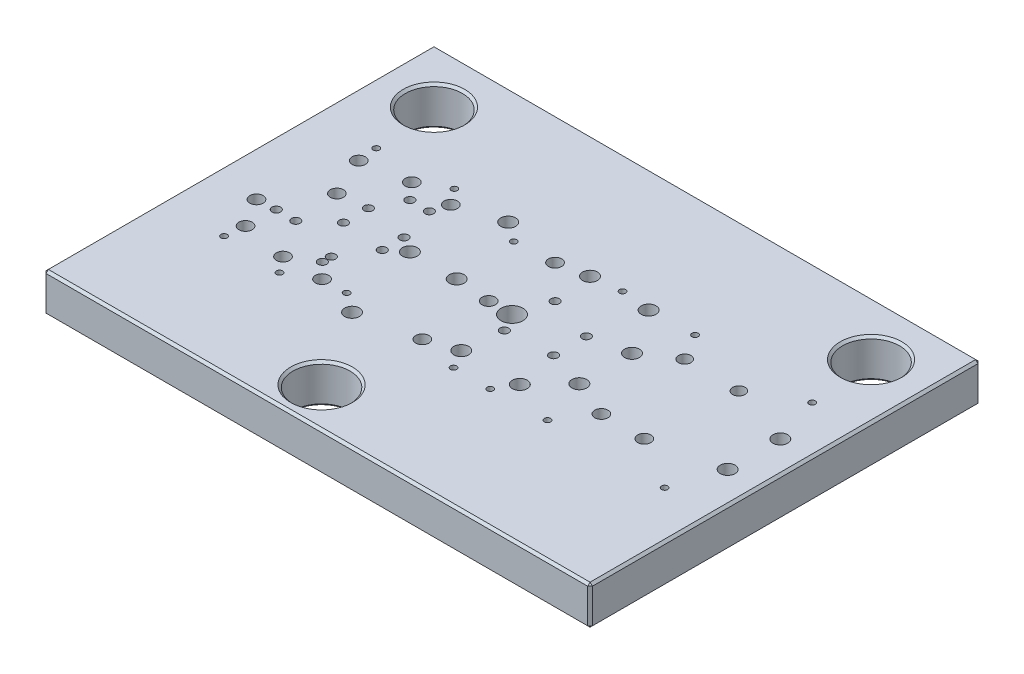
from build123d import *

# Parameters (mm, degrees)
SKETCH1_W                  = 700
SKETCH1_H                  = 500
BOSS_EXTRUDE1_DEPTH        = 50
CUT_EXTRUDE1_REACH         = 435.013
SKETCH2_R                  = 36.5
CHAMFER1_SIZE              = 3
CHAMFER2_SIZE              = 3
M30X2_0_TAPPED_HOLE1_D     = 28
CUT_EXTRUDE2_REACH         = 435.013
SKETCH7_R                  = 6
CUT_EXTRUDE3_REACH         = 435.013
SKETCH8_R                  = 8.5
CUT_EXTRUDE4_REACH         = 435.013
SKETCH9_R                  = 8
SKETCH11_R                 = 9.5
CUT_EXTRUDE5_DEPTH         = 36.8
M10_TAPPED_HOLE1_D         = 8.5
M10_TAPPED_HOLE1_DEPTH     = 27.5
M10_TAPPED_HOLE1_TIP       = 2.553657631
F_8_0MM_DOWEL_HOLE1_D      = 8
M8_TAPPED_HOLE1_D          = 6.8
M8_TAPPED_HOLE1_DEPTH      = 22.25
M8_TAPPED_HOLE1_TIP        = 2.042926105
F_8_0MM_DOWEL_HOLE2_D      = 8
F_11_0_11_DIAMETER_HOLE1_D = 11
SKETCH27_R                 = 6
CUT_EXTRUDE6_DEPTH         = 434.012701892
SKETCH29_R                 = 9.5
CUT_EXTRUDE7_DEPTH         = 36.8
SKETCH30_R                 = 5
CUT_EXTRUDE8_DEPTH         = 434.012701892
SKETCH31_R                 = 8.5
CUT_EXTRUDE9_DEPTH         = 39.8
M8_TAPPED_HOLE2_D          = 6.8
M8_TAPPED_HOLE2_DEPTH      = 22.25
M8_TAPPED_HOLE2_TIP        = 2.042926105
F_8_0MM_DOWEL_HOLE3_D      = 8
SKETCH38_R                 = 6
CUT_EXTRUDE10_DEPTH        = 434.012701892
SKETCH39_R                 = 9.5
CUT_EXTRUDE11_DEPTH        = 36.8
SKETCH40_R                 = 10
CUT_EXTRUDE12_DEPTH        = 9.2
F_10_0_10_DIAMETER_HOLE1_D = 10
SKETCH45_R                 = 8.5
CUT_EXTRUDE13_DEPTH        = 33.8
F_11_0_11_DIAMETER_HOLE2_D = 11
M8_TAPPED_HOLE3_D          = 6.8
M8_TAPPED_HOLE3_DEPTH      = 22.25
M8_TAPPED_HOLE3_TIP        = 2.042926105
F_8_0MM_DOWEL_HOLE4_D      = 8
SKETCH57_R                 = 5
CUT_EXTRUDE14_DEPTH        = 434.012701892
SKETCH58_R                 = 8.5
CUT_EXTRUDE15_DEPTH        = 36.8
F_11_0_11_DIAMETER_HOLE3_D = 11
M8_TAPPED_HOLE4_D          = 6.8
M8_TAPPED_HOLE4_DEPTH      = 22.25
M8_TAPPED_HOLE4_TIP        = 2.042926105
F_8_0MM_DOWEL_HOLE5_D      = 8
M10_TAPPED_HOLE2_D         = 8.5
M10_TAPPED_HOLE2_DEPTH     = 27.5
M10_TAPPED_HOLE2_TIP       = 2.553657631


with BuildPart() as part:
    # Sketch1 → Boss-Extrude1 (new body)
    with BuildSketch(Plane(origin=(0, 0, 0), x_dir=(1, 0, 0), z_dir=(0, 1, 0))):
        Rectangle(SKETCH1_W, SKETCH1_H)
    extrude(amount=-BOSS_EXTRUDE1_DEPTH)

    # Sketch2 → Cut-Extrude1 (cut, up to next)
    with BuildSketch(Plane(origin=(0, 0, 0), x_dir=(1, 0, 0), z_dir=(0, 1, 0)), mode=Mode.PRIVATE) as cut_extrude1_sk1:
        with Locations((-280, 180)):
            Circle(SKETCH2_R)
    cut_extrude1_tool1 = extrude(cut_extrude1_sk1.sketch, amount=-CUT_EXTRUDE1_REACH, mode=Mode.PRIVATE) & part.part
    # Sketch2 → Cut-Extrude1 (cut, up to next)
    with BuildSketch(Plane(origin=(0, 0, 0), x_dir=(1, 0, 0), z_dir=(0, 1, 0)), mode=Mode.PRIVATE) as cut_extrude1_sk2:
        with Locations((280, 180)):
            Circle(SKETCH2_R)
    cut_extrude1_tool2 = extrude(cut_extrude1_sk2.sketch, amount=-CUT_EXTRUDE1_REACH, mode=Mode.PRIVATE) & part.part
    # Sketch2 → Cut-Extrude1 (cut, up to next)
    with BuildSketch(Plane(origin=(0, 0, 0), x_dir=(1, 0, 0), z_dir=(0, 1, 0)), mode=Mode.PRIVATE) as cut_extrude1_sk3:
        with Locations((-44, -200)):
            Circle(SKETCH2_R)
    cut_extrude1_tool3 = extrude(cut_extrude1_sk3.sketch, amount=-CUT_EXTRUDE1_REACH, mode=Mode.PRIVATE) & part.part
    add(cut_extrude1_tool1.solids().sort_by_distance((-280, 0, -180))[0], mode=Mode.SUBTRACT)
    add(cut_extrude1_tool2.solids().sort_by_distance((280, 0, -180))[0], mode=Mode.SUBTRACT)
    add(cut_extrude1_tool3.solids().sort_by_distance((-44, 0, 200))[0], mode=Mode.SUBTRACT)

    # Chamfer1
    chamfer1_edges = [part.edges().sort_by_distance(p)[0] for p in [
        (243.5, -50, -180),
        (243.5, 0, -180),
        (-316.5, -50, -180),
        (-316.5, 0, -180),
        (-80.5, -50, 200),
        (-80.5, 0, 200),
    ]]
    chamfer(chamfer1_edges, length=CHAMFER1_SIZE)

    # Chamfer2
    chamfer2_edges = [part.edges().sort_by_distance(p)[0] for p in [
        (-350, -25, -250),
        (-350, -25, 250),
        (350, -25, -250),
        (0, -50, -250),
        (-350, -50, 0),
        (0, -50, 250),
        (350, -50, 0),
        (350, -25, 250),
        (350, 0, 0),
        (0, 0, -250),
        (-350, 0, 0),
        (0, 0, 250),
    ]]
    chamfer(chamfer2_edges, length=CHAMFER2_SIZE)

    # M30x2.0 Tapped Hole1 (through all)
    with Locations(Plane(origin=(0, 0, 0), x_dir=(1, 0, 0), z_dir=(0, 1, 0))):
        with Locations((0, 0)):
            Hole(M30X2_0_TAPPED_HOLE1_D / 2)

    # Sketch7 → Cut-Extrude2 (cut, up to next)
    with BuildSketch(Plane(origin=(0, 0, 0), x_dir=(1, 0, 0), z_dir=(0, 1, 0)), mode=Mode.PRIVATE) as cut_extrude2_sk1:
        with Locations((310, 33.75)):
            Circle(SKETCH7_R)
    cut_extrude2_tool1 = extrude(cut_extrude2_sk1.sketch, amount=-CUT_EXTRUDE2_REACH, mode=Mode.PRIVATE) & part.part
    # Sketch7 → Cut-Extrude2 (cut, up to next)
    with BuildSketch(Plane(origin=(0, 0, 0), x_dir=(1, 0, 0), z_dir=(0, 1, 0)), mode=Mode.PRIVATE) as cut_extrude2_sk2:
        with Locations((310, -33.75)):
            Circle(SKETCH7_R)
    cut_extrude2_tool2 = extrude(cut_extrude2_sk2.sketch, amount=-CUT_EXTRUDE2_REACH, mode=Mode.PRIVATE) & part.part
    # Sketch7 → Cut-Extrude2 (cut, up to next)
    with BuildSketch(Plane(origin=(0, 0, 0), x_dir=(1, 0, 0), z_dir=(0, 1, 0)), mode=Mode.PRIVATE) as cut_extrude2_sk3:
        with Locations((120, -33.75)):
            Circle(SKETCH7_R)
    cut_extrude2_tool3 = extrude(cut_extrude2_sk3.sketch, amount=-CUT_EXTRUDE2_REACH, mode=Mode.PRIVATE) & part.part
    # Sketch7 → Cut-Extrude2 (cut, up to next)
    with BuildSketch(Plane(origin=(0, 0, 0), x_dir=(1, 0, 0), z_dir=(0, 1, 0)), mode=Mode.PRIVATE) as cut_extrude2_sk4:
        with Locations((120, 33.75)):
            Circle(SKETCH7_R)
    cut_extrude2_tool4 = extrude(cut_extrude2_sk4.sketch, amount=-CUT_EXTRUDE2_REACH, mode=Mode.PRIVATE) & part.part
    add(cut_extrude2_tool1.solids().sort_by_distance((310, 0, -33.75))[0], mode=Mode.SUBTRACT)
    add(cut_extrude2_tool2.solids().sort_by_distance((310, 0, 33.75))[0], mode=Mode.SUBTRACT)
    add(cut_extrude2_tool3.solids().sort_by_distance((120, 0, 33.75))[0], mode=Mode.SUBTRACT)
    add(cut_extrude2_tool4.solids().sort_by_distance((120, 0, -33.75))[0], mode=Mode.SUBTRACT)

    # Sketch8 → Cut-Extrude3 (cut, up to next)
    with BuildSketch(Plane(origin=(0, 0, 0), x_dir=(1, 0, 0), z_dir=(0, 1, 0)), mode=Mode.PRIVATE) as cut_extrude3_sk1:
        with Locations((222.63, -53.14)):
            Circle(SKETCH8_R)
    cut_extrude3_tool1 = extrude(cut_extrude3_sk1.sketch, amount=-CUT_EXTRUDE3_REACH, mode=Mode.PRIVATE) & part.part
    # Sketch8 → Cut-Extrude3 (cut, up to next)
    with BuildSketch(Plane(origin=(0, 0, 0), x_dir=(1, 0, 0), z_dir=(0, 1, 0)), mode=Mode.PRIVATE) as cut_extrude3_sk2:
        with Locations((167.63, -53.14)):
            Circle(SKETCH8_R)
    cut_extrude3_tool2 = extrude(cut_extrude3_sk2.sketch, amount=-CUT_EXTRUDE3_REACH, mode=Mode.PRIVATE) & part.part
    add(cut_extrude3_tool1.solids().sort_by_distance((222.63, 0, 53.14))[0], mode=Mode.SUBTRACT)
    add(cut_extrude3_tool2.solids().sort_by_distance((167.63, 0, 53.14))[0], mode=Mode.SUBTRACT)

    # Sketch9 → Cut-Extrude4 (cut, up to next)
    with BuildSketch(Plane(origin=(0, 0, 0), x_dir=(1, 0, 0), z_dir=(0, 1, 0)), mode=Mode.PRIVATE) as cut_extrude4_sk1:
        with Locations((160.13, 61.13)):
            Circle(SKETCH9_R)
    cut_extrude4_tool1 = extrude(cut_extrude4_sk1.sketch, amount=-CUT_EXTRUDE4_REACH, mode=Mode.PRIVATE) & part.part
    # Sketch9 → Cut-Extrude4 (cut, up to next)
    with BuildSketch(Plane(origin=(0, 0, 0), x_dir=(1, 0, 0), z_dir=(0, 1, 0)), mode=Mode.PRIVATE) as cut_extrude4_sk2:
        with Locations((230.13, 60.5)):
            Circle(SKETCH9_R)
    cut_extrude4_tool2 = extrude(cut_extrude4_sk2.sketch, amount=-CUT_EXTRUDE4_REACH, mode=Mode.PRIVATE) & part.part
    add(cut_extrude4_tool1.solids().sort_by_distance((160.13, 0, -61.13))[0], mode=Mode.SUBTRACT)
    add(cut_extrude4_tool2.solids().sort_by_distance((230.13, 0, -60.5))[0], mode=Mode.SUBTRACT)

    # Sketch11 → Cut-Extrude5 (cut)
    with BuildSketch(Plane(origin=(0, 0, 0), x_dir=(1, 0, 0), z_dir=(0, 1, 0))):
        with Locations((310, -33.75)):
            Circle(SKETCH11_R)
        with Locations((310, 33.75)):
            Circle(SKETCH11_R)
        with Locations((120, -33.75)):
            Circle(SKETCH11_R)
        with Locations((120, 33.75)):
            Circle(SKETCH11_R)
    extrude(amount=-CUT_EXTRUDE5_DEPTH, mode=Mode.SUBTRACT)

    # M10 Tapped Hole1
    with Locations(Plane(origin=(0, -50, 0), x_dir=(-1, 0, 0), z_dir=(0, -1, 0))):
        with Locations((-307, -94.5), (-123, -94.5), (-123, 94.5), (-307, 94.5)):
            Hole(M10_TAPPED_HOLE1_D / 2, depth=M10_TAPPED_HOLE1_DEPTH)
            with Locations((0, 0, -(M10_TAPPED_HOLE1_DEPTH + M10_TAPPED_HOLE1_TIP / 2))):  # 118° drill point
                Cone(0, M10_TAPPED_HOLE1_D / 2, M10_TAPPED_HOLE1_TIP, mode=Mode.SUBTRACT)

    # Ø8.0mm Dowel Hole1 (through all)
    with Locations(Plane(origin=(0, 0, 0), x_dir=(1, 0, 0), z_dir=(0, 1, 0))):
        with Locations((290, 94.5), (140, 94.5), (290, -94.5), (140, -94.5)):
            Hole(F_8_0MM_DOWEL_HOLE1_D / 2)

    # M8 Tapped Hole1
    with Locations(Plane.XZ.offset(50)):
        with Locations((62.13, -96.5), (28.13, -96.5), (84.13, 96.5), (6.13, 96.5)):
            Hole(M8_TAPPED_HOLE1_D / 2, depth=M8_TAPPED_HOLE1_DEPTH)
            with Locations((0, 0, -(M8_TAPPED_HOLE1_DEPTH + M8_TAPPED_HOLE1_TIP / 2))):  # 118° drill point
                Cone(0, M8_TAPPED_HOLE1_D / 2, M8_TAPPED_HOLE1_TIP, mode=Mode.SUBTRACT)

    # Ø8.0mm Dowel Hole2 (through all)
    with Locations(Plane(origin=(0, 0, 0), x_dir=(1, 0, 0), z_dir=(0, 1, 0))):
        with Locations((68.63, -96.5), (21.63, -96.5), (45.13, 96.5)):
            Hole(F_8_0MM_DOWEL_HOLE2_D / 2)

    # Ø11.0 (11) Diameter Hole1 (through all)
    with Locations(Plane(origin=(0, 0, 0), x_dir=(1, 0, 0), z_dir=(0, 1, 0))):
        with Locations((71.88, -18.64), (12.88, -22.64), (71.88, 23.36), (12.88, 42.36)):
            Hole(F_11_0_11_DIAMETER_HOLE1_D / 2)

    # Sketch27 → Cut-Extrude6 (cut, through all)
    with BuildSketch(Plane(origin=(0, 0, 0), x_dir=(1, 0, 0), z_dir=(0, 1, 0))):
        with Locations((7.63, 92.36)):
            Circle(SKETCH27_R)
        with Locations((82.63, 92.36)):
            Circle(SKETCH27_R)
        with Locations((82.63, -72.64)):
            Circle(SKETCH27_R)
        with Locations((7.63, -72.64)):
            Circle(SKETCH27_R)
    extrude(amount=-CUT_EXTRUDE6_DEPTH, mode=Mode.SUBTRACT)

    # Sketch29 → Cut-Extrude7 (cut)
    with BuildSketch(Plane(origin=(0, 0, 0), x_dir=(1, 0, 0), z_dir=(0, 1, 0))):
        with Locations((7.63, 92.36)):
            Circle(SKETCH29_R)
        with Locations((82.63, 92.36)):
            Circle(SKETCH29_R)
        with Locations((7.63, -72.64)):
            Circle(SKETCH29_R)
        with Locations((82.63, -72.64)):
            Circle(SKETCH29_R)
    extrude(amount=-CUT_EXTRUDE7_DEPTH, mode=Mode.SUBTRACT)

    # Sketch30 → Cut-Extrude8 (cut, through all)
    with BuildSketch(Plane(origin=(0, 0, 0), x_dir=(1, 0, 0), z_dir=(0, 1, 0))):
        with Locations((-29.87, 85)):
            Circle(SKETCH30_R)
        with Locations((-29.87, 0)):
            Circle(SKETCH30_R)
        with Locations((-29.87, -85)):
            Circle(SKETCH30_R)
    extrude(amount=-CUT_EXTRUDE8_DEPTH, mode=Mode.SUBTRACT)

    # Sketch31 → Cut-Extrude9 (cut)
    with BuildSketch(Plane(origin=(0, 0, 0), x_dir=(1, 0, 0), z_dir=(0, 1, 0))):
        with Locations((-29.87, 85)):
            Circle(SKETCH31_R)
        with Locations((-29.87, 0)):
            Circle(SKETCH31_R)
        with Locations((-29.87, -85)):
            Circle(SKETCH31_R)
    extrude(amount=-CUT_EXTRUDE9_DEPTH, mode=Mode.SUBTRACT)

    # M8 Tapped Hole2
    with Locations(Plane(origin=(0, -50, 0), x_dir=(-1, 0, 0), z_dir=(0, -1, 0))):
        with Locations((79.87, -97.5), (129.87, -97.5), (79.87, 97.5), (129.87, 97.5)):
            Hole(M8_TAPPED_HOLE2_D / 2, depth=M8_TAPPED_HOLE2_DEPTH)
            with Locations((0, 0, -(M8_TAPPED_HOLE2_DEPTH + M8_TAPPED_HOLE2_TIP / 2))):  # 118° drill point
                Cone(0, M8_TAPPED_HOLE2_D / 2, M8_TAPPED_HOLE2_TIP, mode=Mode.SUBTRACT)

    # Ø8.0mm Dowel Hole3 (through all)
    with Locations(Plane(origin=(0, 0, 0), x_dir=(1, 0, 0), z_dir=(0, 1, 0))):
        with Locations((-79.87, 81.975), (-129.87, -82)):
            Hole(F_8_0MM_DOWEL_HOLE3_D / 2)

    # Sketch38 → Cut-Extrude10 (cut, through all)
    with BuildSketch(Plane(origin=(0, 0, 0), x_dir=(1, 0, 0), z_dir=(0, 1, 0))):
        with Locations((-104.87, 100)):
            Circle(SKETCH38_R)
        with Locations((-104.87, -100)):
            Circle(SKETCH38_R)
        with Locations((-74.87, 4)):
            Circle(SKETCH38_R)
        with Locations((-134.87, 4)):
            Circle(SKETCH38_R)
    extrude(amount=-CUT_EXTRUDE10_DEPTH, mode=Mode.SUBTRACT)

    # Sketch39 → Cut-Extrude11 (cut)
    with BuildSketch(Plane(origin=(0, 0, 0), x_dir=(1, 0, 0), z_dir=(0, 1, 0))):
        with Locations((-104.87, 100)):
            Circle(SKETCH39_R)
        with Locations((-104.87, -100)):
            Circle(SKETCH39_R)
        with Locations((-74.87, 4)):
            Circle(SKETCH39_R)
        with Locations((-134.87, 4)):
            Circle(SKETCH39_R)
    extrude(amount=-CUT_EXTRUDE11_DEPTH, mode=Mode.SUBTRACT)

    # Sketch40 → Cut-Extrude12 (cut)
    with BuildSketch(Plane.XZ.offset(50)):
        with Locations((-185.87, -82.5)):
            Circle(SKETCH40_R)
        with Locations((-210.87, 82.5)):
            Circle(SKETCH40_R)
        with Locations((-185.87, 82.5)):
            Circle(SKETCH40_R)
        with Locations((-160.87, 82.5)):
            Circle(SKETCH40_R)
        with Locations((-160.87, 33)):
            Circle(SKETCH40_R)
        with Locations((-210.87, 33)):
            Circle(SKETCH40_R)
        with Locations((-160.87, -39)):
            Circle(SKETCH40_R)
        with Locations((-160.87, -82.5)):
            Circle(SKETCH40_R)
        with Locations((-210.87, -82.5)):
            Circle(SKETCH40_R)
        with Locations((-210.87, -47)):
            Circle(SKETCH40_R)
    extrude(amount=-CUT_EXTRUDE12_DEPTH, mode=Mode.SUBTRACT)

    # Ø10.0 (10) Diameter Hole1 (through all)
    with Locations(Plane(origin=(0, 0, 0), x_dir=(1, 0, 0), z_dir=(0, 1, 0))):
        with Locations((-160.87, 82.5), (-210.87, 82.5), (-160.87, -82.5), (-210.87, -82.5)):
            Hole(F_10_0_10_DIAMETER_HOLE1_D / 2)

    # Sketch45 → Cut-Extrude13 (cut)
    with BuildSketch(Plane(origin=(0, 0, 0), x_dir=(1, 0, 0), z_dir=(0, 1, 0))):
        with Locations((-160.87, 82.5)):
            Circle(SKETCH45_R)
        with Locations((-210.87, 82.5)):
            Circle(SKETCH45_R)
        with Locations((-160.87, -82.5)):
            Circle(SKETCH45_R)
        with Locations((-210.87, -82.5)):
            Circle(SKETCH45_R)
    extrude(amount=-CUT_EXTRUDE13_DEPTH, mode=Mode.SUBTRACT)

    # Ø11.0 (11) Diameter Hole2 (through all)
    with Locations(Plane(origin=(0, 0, 0), x_dir=(1, 0, 0), z_dir=(0, 1, 0))):
        with Locations((-167.37, 61.5), (-192.37, 61.5), (-154.62, 16.36), (-209.87, 25.86), (-209.87, -6.14), (-179.87, -51.64), (-179.87, -63.14), (-154.62, -11.64)):
            Hole(F_11_0_11_DIAMETER_HOLE2_D / 2)

    # M8 Tapped Hole3
    with Locations(Plane(origin=(0, -50, 0), x_dir=(-1, 0, 0), z_dir=(0, -1, 0))):
        with Locations((160.87, -102.5), (210.87, -102.5), (160.87, 102.5), (210.87, 102.5)):
            Hole(M8_TAPPED_HOLE3_D / 2, depth=M8_TAPPED_HOLE3_DEPTH)
            with Locations((0, 0, -(M8_TAPPED_HOLE3_DEPTH + M8_TAPPED_HOLE3_TIP / 2))):  # 118° drill point
                Cone(0, M8_TAPPED_HOLE3_D / 2, M8_TAPPED_HOLE3_TIP, mode=Mode.SUBTRACT)

    # Ø8.0mm Dowel Hole4 (through all)
    with Locations(Plane(origin=(0, 0, 0), x_dir=(1, 0, 0), z_dir=(0, 1, 0))):
        with Locations((-176.37, 102.5), (-195.37, -102.5)):
            Hole(F_8_0MM_DOWEL_HOLE4_D / 2)

    # Sketch57 → Cut-Extrude14 (cut, through all)
    with BuildSketch(Plane(origin=(0, 0, 0), x_dir=(1, 0, 0), z_dir=(0, 1, 0))):
        with Locations((-268.87, -72.5)):
            Circle(SKETCH57_R)
        with Locations((-291.37, -36)):
            Circle(SKETCH57_R)
        with Locations((-246.37, 22)):
            Circle(SKETCH57_R)
        with Locations((-268.87, 72.5)):
            Circle(SKETCH57_R)
    extrude(amount=-CUT_EXTRUDE14_DEPTH, mode=Mode.SUBTRACT)

    # Sketch58 → Cut-Extrude15 (cut)
    with BuildSketch(Plane(origin=(0, 0, 0), x_dir=(1, 0, 0), z_dir=(0, 1, 0))):
        with Locations((-268.87, 72.5)):
            Circle(SKETCH58_R)
        with Locations((-246.37, 22)):
            Circle(SKETCH58_R)
        with Locations((-291.37, -36)):
            Circle(SKETCH58_R)
        with Locations((-268.87, -72.5)):
            Circle(SKETCH58_R)
    extrude(amount=-CUT_EXTRUDE15_DEPTH, mode=Mode.SUBTRACT)

    # Ø11.0 (11) Diameter Hole3 (through all)
    with Locations(Plane(origin=(0, 0, 0), x_dir=(1, 0, 0), z_dir=(0, 1, 0))):
        with Locations((-267.37, -34.64), (-242.37, -34.64)):
            Hole(F_11_0_11_DIAMETER_HOLE3_D / 2)

    # M8 Tapped Hole4
    with Locations(Plane.XZ.offset(50)):
        with Locations((-291.37, -97.5), (-251.37, -97.5), (-251.37, 97.5), (-291.37, 97.5)):
            Hole(M8_TAPPED_HOLE4_D / 2, depth=M8_TAPPED_HOLE4_DEPTH)
            with Locations((0, 0, -(M8_TAPPED_HOLE4_DEPTH + M8_TAPPED_HOLE4_TIP / 2))):  # 118° drill point
                Cone(0, M8_TAPPED_HOLE4_D / 2, M8_TAPPED_HOLE4_TIP, mode=Mode.SUBTRACT)

    # Ø8.0mm Dowel Hole5 (through all)
    with Locations(Plane(origin=(0, 0, 0), x_dir=(1, 0, 0), z_dir=(0, 1, 0))):
        with Locations((-271.37, -97.5), (-271.37, 97.5)):
            Hole(F_8_0MM_DOWEL_HOLE5_D / 2)

    # M10 Tapped Hole2
    with Locations(Plane(origin=(0, -50, 0), x_dir=(-1, 0, 0), z_dir=(0, -1, 0))):
        with Locations((-300, -190), (190, 190)):
            Hole(M10_TAPPED_HOLE2_D / 2, depth=M10_TAPPED_HOLE2_DEPTH)
            with Locations((0, 0, -(M10_TAPPED_HOLE2_DEPTH + M10_TAPPED_HOLE2_TIP / 2))):  # 118° drill point
                Cone(0, M10_TAPPED_HOLE2_D / 2, M10_TAPPED_HOLE2_TIP, mode=Mode.SUBTRACT)


solid = part.part
